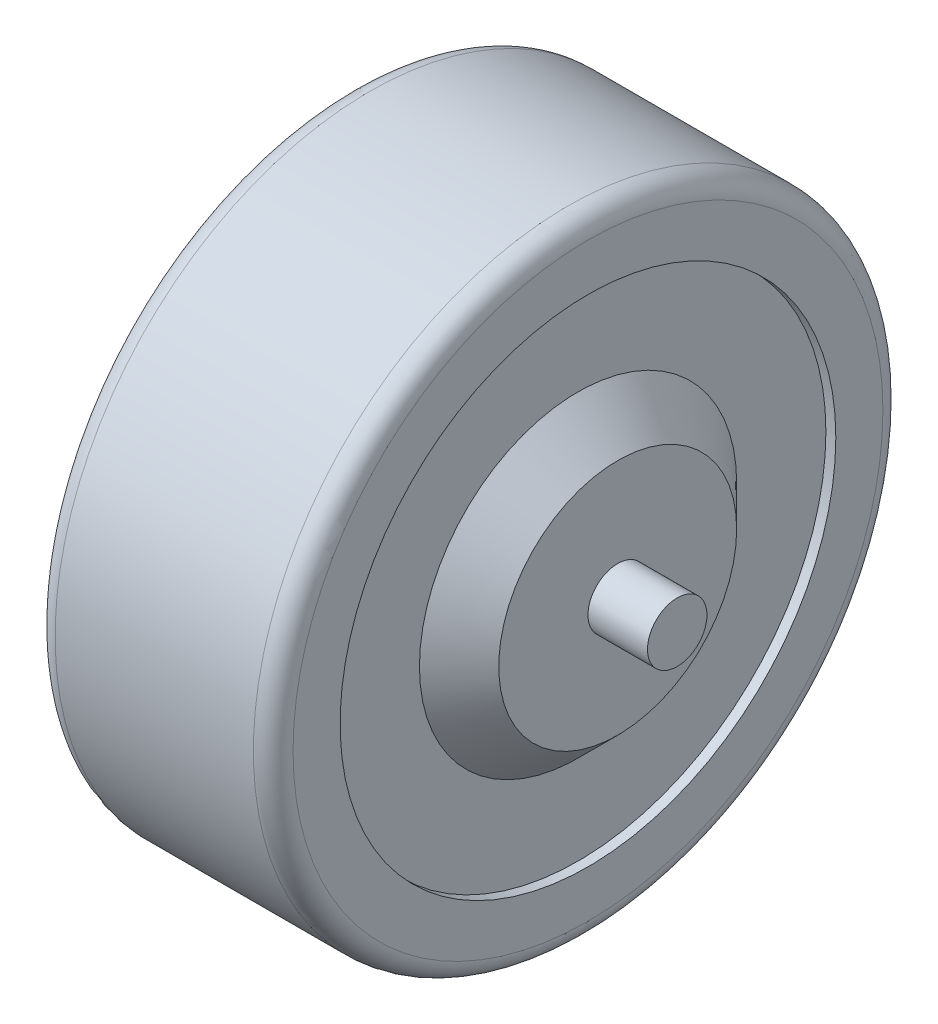
from build123d import *

# Parameters (mm, degrees)
BOSS_EXTRUDE1_DEPTH      = 12
BOSS_EXTRUDE1_DEPTH_BACK = 12
SKETCH1_R                = 31.75
SKETCH2_R                = 25
SKETCH2_R_2              = 16
CUT_EXTRUDE1_DEPTH       = 1
BOSS_EXTRUDE2_START      = 3
SKETCH3_R                = 16
BOSS_EXTRUDE2_DEPTH      = 3
CHAMFER2_SIZE            = 4
FILLET1_R                = 2
SKETCH4_R                = 3
BOSS_EXTRUDE3_DEPTH      = 6
SCALE1_SCALE             = 0.7761


with BuildPart() as part:
    # Sketch1 → Boss-Extrude1 (new, two sides: drawn at the far end of the back side and taken through both)
    with BuildSketch(Plane(origin=(0, 0, 0), x_dir=(0, 0, -1), z_dir=(1, 0, 0)).offset(-BOSS_EXTRUDE1_DEPTH_BACK)):
        Circle(SKETCH1_R)
    extrude(amount=BOSS_EXTRUDE1_DEPTH + BOSS_EXTRUDE1_DEPTH_BACK)

    # Sketch2 → Cut-Extrude1 (cut)
    with BuildSketch(Plane(origin=(12, 0, 0), x_dir=(0, 0, -1), z_dir=(1, 0, 0))):
        Circle(SKETCH2_R)
        Circle(SKETCH2_R_2, mode=Mode.SUBTRACT)
    cut_extrude1 = extrude(amount=-CUT_EXTRUDE1_DEPTH, mode=Mode.SUBTRACT)

    # Sketch3 → Boss-Extrude2 (add)
    with BuildSketch(Plane(origin=(12, 0, 0), x_dir=(0, 0, -1), z_dir=(1, 0, 0)).offset(BOSS_EXTRUDE2_START)):
        Circle(SKETCH3_R)
    boss_extrude2 = extrude(amount=-BOSS_EXTRUDE2_DEPTH)

    # Mirror1: Cut-Extrude1, Boss-Extrude2 across plane
    add(cut_extrude1.mirror(Plane(origin=(0, 0, 0), x_dir=(0, 0, 1), z_dir=(1, 0, 0))), mode=Mode.SUBTRACT)
    add(boss_extrude2.mirror(Plane(origin=(0, 0, 0), x_dir=(0, 0, 1), z_dir=(1, 0, 0))))

    # Chamfer2
    # the kernel refuses this chamfer: 4 mm, written as the material it takes off along each edge
    with BuildSketch(Plane(origin=(15, 0, 0), x_dir=(0, 0, -1), z_dir=(0, -1, 0))) as chamfer2_piece_1_section:
        Polygon((16, -CHAMFER2_SIZE), (16 - CHAMFER2_SIZE, 0), (16, 0), align=None)
    chamfer2_piece_1 = revolve(axis=Axis((15, 0, 0), (1, 0, 0)), mode=Mode.PRIVATE)
    chamfer2_piece_1 = split(chamfer2_piece_1, bisect_by=Plane(origin=(11, 0, 14.009360732), z_dir=(1, 0, 0)), keep=Keep.TOP, mode=Mode.PRIVATE)
    add(chamfer2_piece_1, mode=Mode.SUBTRACT)
    with BuildSketch(Plane(origin=(-15, 0, 0), x_dir=(0, 0, -1), z_dir=(0, -1, 0))) as chamfer2_piece_2_section:
        Polygon((16, CHAMFER2_SIZE), (16 - CHAMFER2_SIZE, 0), (16, 0), align=None)
    chamfer2_piece_2 = revolve(axis=Axis((-15, 0, 0), (1, 0, 0)), mode=Mode.PRIVATE)
    chamfer2_piece_2 = split(chamfer2_piece_2, bisect_by=Plane(origin=(-11, 0, 14.009360732), z_dir=(-1, 0, 0)), keep=Keep.TOP, mode=Mode.PRIVATE)
    add(chamfer2_piece_2, mode=Mode.SUBTRACT)

    # Fillet1
    fillet1_edges = [part.edges().sort_by_distance(p)[0] for p in [
        (-12, 0, 31.75),
        (12, 0, 31.75),
    ]]
    fillet(fillet1_edges, radius=FILLET1_R)

    # Sketch4 → Boss-Extrude3 (add)
    with BuildSketch(Plane(origin=(15, 0, 0), x_dir=(0, 0, -1), z_dir=(1, 0, 0))):
        Circle(SKETCH4_R)
    boss_extrude3 = extrude(amount=BOSS_EXTRUDE3_DEPTH)

    # Mirror2: Boss-Extrude3 across plane
    add(boss_extrude3.mirror(Plane(origin=(0, 0, 0), x_dir=(0, 0, 1), z_dir=(1, 0, 0))))


with BuildPart() as part_1:
    # Scale1: scaled about (0, 0, 0)
    add(part.part.scale(SCALE1_SCALE))


solid = part_1.part
